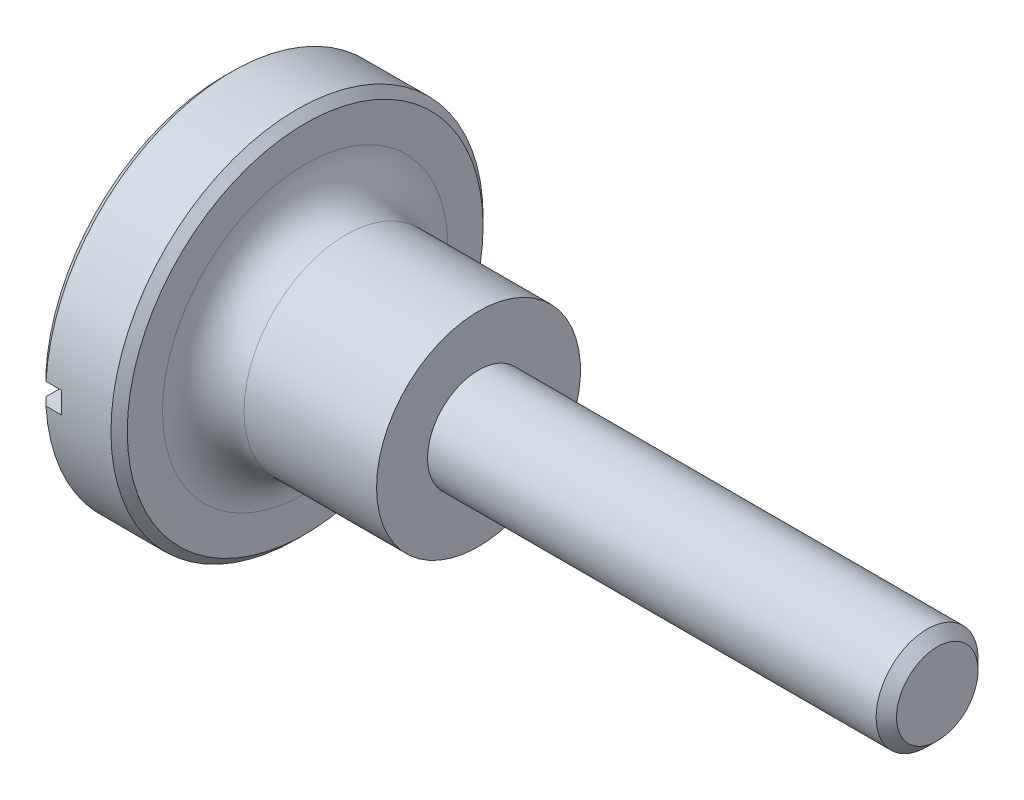
from build123d import *

# Parameters (mm, degrees)
SLOT_DEPTH      = 75.606467548
SLOT_DEPTH_BACK = 75.606467548
SLOTSKE_W       = 4.69310445
SLOTSKE_H       = 2.101390052
FILLET1_R       = 4


with BuildPart() as part:
    # BodySke → Base-Revolve (revolve)
    with BuildSketch(Plane.XY):
        Polygon((69, 5), (70, 4), (70, 0), (0, 0), (0, 17.45), (0.8, 18.25), (7.2, 18.25), (8, 17.45), (8, 10), (25, 10), (25, 5), align=None)
    revolve(axis=Axis((-25.4, 0, 0), (1, 0, 0)))

    # SlotSke → Slot (cut, two sides: drawn at the far end of the back side and taken through both)
    with BuildSketch(Plane.XY.offset(-SLOT_DEPTH_BACK)):
        Rectangle(SLOTSKE_W, SLOTSKE_H)
    extrude(amount=SLOT_DEPTH + SLOT_DEPTH_BACK, mode=Mode.SUBTRACT)

    # Fillet1
    fillet1_edges = [part.edges().sort_by_distance(p)[0] for p in [
        (8, -10, 0),
    ]]
    fillet(fillet1_edges, radius=FILLET1_R)


solid = part.part
